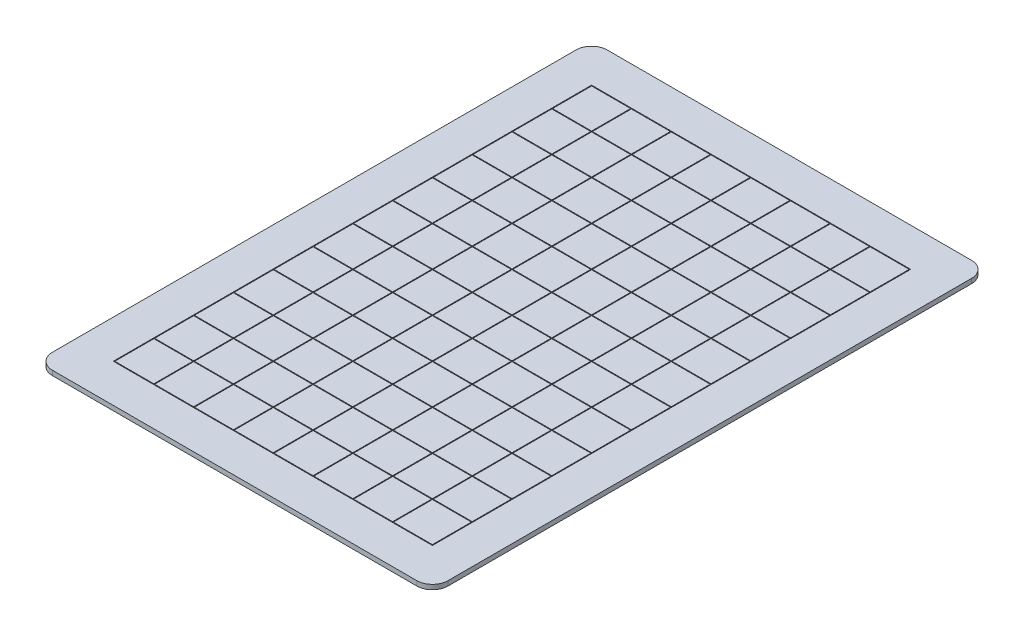
from build123d import *

# Parameters (mm, degrees)
SKETCH1_W           = 253.5
SKETCH1_H           = 355.5
BOSS_EXTRUDE1_DEPTH = 3
SKETCH2_W           = 204.5
SKETCH2_H           = 306.5
SKETCH2_W_2         = 25
SKETCH2_H_2         = 25
CUT_EXTRUDE1_DEPTH  = 0.5
SKETCH4_R           = 1.6
CUT_EXTRUDE2_DEPTH  = 1.2
FILLET1_R           = 10
SKETCH5_W           = 5
SKETCH5_H           = 4
SKETCH5_H_2         = 4.38
CUT_EXTRUDE3_DEPTH  = 2
SKETCH5_3_W         = 5
SKETCH5_3_H         = 4
SKETCH5_3_H_2       = 4.38
CUT_EXTRUDE4_DEPTH  = 2
SKETCH6_W           = 5
SKETCH6_H           = 4
CUT_EXTRUDE6_DEPTH  = 2.5


with BuildPart() as part:
    # Sketch1 → Boss-Extrude1 (new body)
    with BuildSketch(Plane(origin=(0, 0, 0), x_dir=(1, 0, 0), z_dir=(0, 1, 0))):
        with Locations((126.75, 177.75)):
            Rectangle(SKETCH1_W, SKETCH1_H)
    extrude(amount=BOSS_EXTRUDE1_DEPTH)

    # Sketch2 → Cut-Extrude1 (cut)
    with BuildSketch(Plane(origin=(0, 3, 0), x_dir=(1, 0, 0), z_dir=(0, 1, 0))):
        with Locations((126.75, 177.75)):
            Rectangle(SKETCH2_W, SKETCH2_H)
        with Locations((37.5, 37.5)):
            Rectangle(SKETCH2_W_2, SKETCH2_H_2, mode=Mode.SUBTRACT)
        with Locations((63, 37.5)):
            Rectangle(SKETCH2_W_2, SKETCH2_H_2, mode=Mode.SUBTRACT)
        with Locations((88.5, 37.5)):
            Rectangle(SKETCH2_W_2, SKETCH2_H_2, mode=Mode.SUBTRACT)
        with Locations((114, 37.5)):
            Rectangle(SKETCH2_W_2, SKETCH2_H_2, mode=Mode.SUBTRACT)
        with Locations((139.5, 37.5)):
            Rectangle(SKETCH2_W_2, SKETCH2_H_2, mode=Mode.SUBTRACT)
        with Locations((165, 37.5)):
            Rectangle(SKETCH2_W_2, SKETCH2_H_2, mode=Mode.SUBTRACT)
        with Locations((190.5, 37.5)):
            Rectangle(SKETCH2_W_2, SKETCH2_H_2, mode=Mode.SUBTRACT)
        with Locations((216, 37.5)):
            Rectangle(SKETCH2_W_2, SKETCH2_H_2, mode=Mode.SUBTRACT)
        with Locations((63, 63)):
            Rectangle(SKETCH2_W_2, SKETCH2_H_2, mode=Mode.SUBTRACT)
        with Locations((88.5, 63)):
            Rectangle(SKETCH2_W_2, SKETCH2_H_2, mode=Mode.SUBTRACT)
        with Locations((114, 63)):
            Rectangle(SKETCH2_W_2, SKETCH2_H_2, mode=Mode.SUBTRACT)
        with Locations((139.5, 63)):
            Rectangle(SKETCH2_W_2, SKETCH2_H_2, mode=Mode.SUBTRACT)
        with Locations((165, 63)):
            Rectangle(SKETCH2_W_2, SKETCH2_H_2, mode=Mode.SUBTRACT)
        with Locations((190.5, 63)):
            Rectangle(SKETCH2_W_2, SKETCH2_H_2, mode=Mode.SUBTRACT)
        with Locations((216, 63)):
            Rectangle(SKETCH2_W_2, SKETCH2_H_2, mode=Mode.SUBTRACT)
        with Locations((63, 88.5)):
            Rectangle(SKETCH2_W_2, SKETCH2_H_2, mode=Mode.SUBTRACT)
        with Locations((88.5, 88.5)):
            Rectangle(SKETCH2_W_2, SKETCH2_H_2, mode=Mode.SUBTRACT)
        with Locations((114, 88.5)):
            Rectangle(SKETCH2_W_2, SKETCH2_H_2, mode=Mode.SUBTRACT)
        with Locations((139.5, 88.5)):
            Rectangle(SKETCH2_W_2, SKETCH2_H_2, mode=Mode.SUBTRACT)
        with Locations((165, 88.5)):
            Rectangle(SKETCH2_W_2, SKETCH2_H_2, mode=Mode.SUBTRACT)
        with Locations((190.5, 88.5)):
            Rectangle(SKETCH2_W_2, SKETCH2_H_2, mode=Mode.SUBTRACT)
        with Locations((216, 88.5)):
            Rectangle(SKETCH2_W_2, SKETCH2_H_2, mode=Mode.SUBTRACT)
        with Locations((63, 114)):
            Rectangle(SKETCH2_W_2, SKETCH2_H_2, mode=Mode.SUBTRACT)
        with Locations((88.5, 114)):
            Rectangle(SKETCH2_W_2, SKETCH2_H_2, mode=Mode.SUBTRACT)
        with Locations((114, 114)):
            Rectangle(SKETCH2_W_2, SKETCH2_H_2, mode=Mode.SUBTRACT)
        with Locations((139.5, 114)):
            Rectangle(SKETCH2_W_2, SKETCH2_H_2, mode=Mode.SUBTRACT)
        with Locations((165, 114)):
            Rectangle(SKETCH2_W_2, SKETCH2_H_2, mode=Mode.SUBTRACT)
        with Locations((190.5, 114)):
            Rectangle(SKETCH2_W_2, SKETCH2_H_2, mode=Mode.SUBTRACT)
        with Locations((216, 114)):
            Rectangle(SKETCH2_W_2, SKETCH2_H_2, mode=Mode.SUBTRACT)
        with Locations((63, 139.5)):
            Rectangle(SKETCH2_W_2, SKETCH2_H_2, mode=Mode.SUBTRACT)
        with Locations((88.5, 139.5)):
            Rectangle(SKETCH2_W_2, SKETCH2_H_2, mode=Mode.SUBTRACT)
        with Locations((114, 139.5)):
            Rectangle(SKETCH2_W_2, SKETCH2_H_2, mode=Mode.SUBTRACT)
        with Locations((139.5, 139.5)):
            Rectangle(SKETCH2_W_2, SKETCH2_H_2, mode=Mode.SUBTRACT)
        with Locations((165, 139.5)):
            Rectangle(SKETCH2_W_2, SKETCH2_H_2, mode=Mode.SUBTRACT)
        with Locations((190.5, 139.5)):
            Rectangle(SKETCH2_W_2, SKETCH2_H_2, mode=Mode.SUBTRACT)
        with Locations((216, 139.5)):
            Rectangle(SKETCH2_W_2, SKETCH2_H_2, mode=Mode.SUBTRACT)
        with Locations((63, 165)):
            Rectangle(SKETCH2_W_2, SKETCH2_H_2, mode=Mode.SUBTRACT)
        with Locations((88.5, 165)):
            Rectangle(SKETCH2_W_2, SKETCH2_H_2, mode=Mode.SUBTRACT)
        with Locations((114, 165)):
            Rectangle(SKETCH2_W_2, SKETCH2_H_2, mode=Mode.SUBTRACT)
        with Locations((139.5, 165)):
            Rectangle(SKETCH2_W_2, SKETCH2_H_2, mode=Mode.SUBTRACT)
        with Locations((165, 165)):
            Rectangle(SKETCH2_W_2, SKETCH2_H_2, mode=Mode.SUBTRACT)
        with Locations((190.5, 165)):
            Rectangle(SKETCH2_W_2, SKETCH2_H_2, mode=Mode.SUBTRACT)
        with Locations((216, 165)):
            Rectangle(SKETCH2_W_2, SKETCH2_H_2, mode=Mode.SUBTRACT)
        with Locations((63, 190.5)):
            Rectangle(SKETCH2_W_2, SKETCH2_H_2, mode=Mode.SUBTRACT)
        with Locations((88.5, 190.5)):
            Rectangle(SKETCH2_W_2, SKETCH2_H_2, mode=Mode.SUBTRACT)
        with Locations((114, 190.5)):
            Rectangle(SKETCH2_W_2, SKETCH2_H_2, mode=Mode.SUBTRACT)
        with Locations((139.5, 190.5)):
            Rectangle(SKETCH2_W_2, SKETCH2_H_2, mode=Mode.SUBTRACT)
        with Locations((165, 190.5)):
            Rectangle(SKETCH2_W_2, SKETCH2_H_2, mode=Mode.SUBTRACT)
        with Locations((190.5, 190.5)):
            Rectangle(SKETCH2_W_2, SKETCH2_H_2, mode=Mode.SUBTRACT)
        with Locations((216, 190.5)):
            Rectangle(SKETCH2_W_2, SKETCH2_H_2, mode=Mode.SUBTRACT)
        with Locations((63, 216)):
            Rectangle(SKETCH2_W_2, SKETCH2_H_2, mode=Mode.SUBTRACT)
        with Locations((88.5, 216)):
            Rectangle(SKETCH2_W_2, SKETCH2_H_2, mode=Mode.SUBTRACT)
        with Locations((114, 216)):
            Rectangle(SKETCH2_W_2, SKETCH2_H_2, mode=Mode.SUBTRACT)
        with Locations((139.5, 216)):
            Rectangle(SKETCH2_W_2, SKETCH2_H_2, mode=Mode.SUBTRACT)
        with Locations((165, 216)):
            Rectangle(SKETCH2_W_2, SKETCH2_H_2, mode=Mode.SUBTRACT)
        with Locations((190.5, 216)):
            Rectangle(SKETCH2_W_2, SKETCH2_H_2, mode=Mode.SUBTRACT)
        with Locations((216, 216)):
            Rectangle(SKETCH2_W_2, SKETCH2_H_2, mode=Mode.SUBTRACT)
        with Locations((63, 241.5)):
            Rectangle(SKETCH2_W_2, SKETCH2_H_2, mode=Mode.SUBTRACT)
        with Locations((88.5, 241.5)):
            Rectangle(SKETCH2_W_2, SKETCH2_H_2, mode=Mode.SUBTRACT)
        with Locations((114, 241.5)):
            Rectangle(SKETCH2_W_2, SKETCH2_H_2, mode=Mode.SUBTRACT)
        with Locations((139.5, 241.5)):
            Rectangle(SKETCH2_W_2, SKETCH2_H_2, mode=Mode.SUBTRACT)
        with Locations((165, 241.5)):
            Rectangle(SKETCH2_W_2, SKETCH2_H_2, mode=Mode.SUBTRACT)
        with Locations((190.5, 241.5)):
            Rectangle(SKETCH2_W_2, SKETCH2_H_2, mode=Mode.SUBTRACT)
        with Locations((216, 241.5)):
            Rectangle(SKETCH2_W_2, SKETCH2_H_2, mode=Mode.SUBTRACT)
        with Locations((63, 267)):
            Rectangle(SKETCH2_W_2, SKETCH2_H_2, mode=Mode.SUBTRACT)
        with Locations((88.5, 267)):
            Rectangle(SKETCH2_W_2, SKETCH2_H_2, mode=Mode.SUBTRACT)
        with Locations((114, 267)):
            Rectangle(SKETCH2_W_2, SKETCH2_H_2, mode=Mode.SUBTRACT)
        with Locations((139.5, 267)):
            Rectangle(SKETCH2_W_2, SKETCH2_H_2, mode=Mode.SUBTRACT)
        with Locations((165, 267)):
            Rectangle(SKETCH2_W_2, SKETCH2_H_2, mode=Mode.SUBTRACT)
        with Locations((190.5, 267)):
            Rectangle(SKETCH2_W_2, SKETCH2_H_2, mode=Mode.SUBTRACT)
        with Locations((216, 267)):
            Rectangle(SKETCH2_W_2, SKETCH2_H_2, mode=Mode.SUBTRACT)
        with Locations((63, 292.5)):
            Rectangle(SKETCH2_W_2, SKETCH2_H_2, mode=Mode.SUBTRACT)
        with Locations((88.5, 292.5)):
            Rectangle(SKETCH2_W_2, SKETCH2_H_2, mode=Mode.SUBTRACT)
        with Locations((114, 292.5)):
            Rectangle(SKETCH2_W_2, SKETCH2_H_2, mode=Mode.SUBTRACT)
        with Locations((139.5, 292.5)):
            Rectangle(SKETCH2_W_2, SKETCH2_H_2, mode=Mode.SUBTRACT)
        with Locations((165, 292.5)):
            Rectangle(SKETCH2_W_2, SKETCH2_H_2, mode=Mode.SUBTRACT)
        with Locations((190.5, 292.5)):
            Rectangle(SKETCH2_W_2, SKETCH2_H_2, mode=Mode.SUBTRACT)
        with Locations((216, 292.5)):
            Rectangle(SKETCH2_W_2, SKETCH2_H_2, mode=Mode.SUBTRACT)
        with Locations((63, 318)):
            Rectangle(SKETCH2_W_2, SKETCH2_H_2, mode=Mode.SUBTRACT)
        with Locations((88.5, 318)):
            Rectangle(SKETCH2_W_2, SKETCH2_H_2, mode=Mode.SUBTRACT)
        with Locations((114, 318)):
            Rectangle(SKETCH2_W_2, SKETCH2_H_2, mode=Mode.SUBTRACT)
        with Locations((139.5, 318)):
            Rectangle(SKETCH2_W_2, SKETCH2_H_2, mode=Mode.SUBTRACT)
        with Locations((165, 318)):
            Rectangle(SKETCH2_W_2, SKETCH2_H_2, mode=Mode.SUBTRACT)
        with Locations((190.5, 318)):
            Rectangle(SKETCH2_W_2, SKETCH2_H_2, mode=Mode.SUBTRACT)
        with Locations((216, 318)):
            Rectangle(SKETCH2_W_2, SKETCH2_H_2, mode=Mode.SUBTRACT)
        with Locations((37.5, 63)):
            Rectangle(SKETCH2_W_2, SKETCH2_H_2, mode=Mode.SUBTRACT)
        with Locations((37.5, 88.5)):
            Rectangle(SKETCH2_W_2, SKETCH2_H_2, mode=Mode.SUBTRACT)
        with Locations((37.5, 114)):
            Rectangle(SKETCH2_W_2, SKETCH2_H_2, mode=Mode.SUBTRACT)
        with Locations((37.5, 139.5)):
            Rectangle(SKETCH2_W_2, SKETCH2_H_2, mode=Mode.SUBTRACT)
        with Locations((37.5, 165)):
            Rectangle(SKETCH2_W_2, SKETCH2_H_2, mode=Mode.SUBTRACT)
        with Locations((37.5, 190.5)):
            Rectangle(SKETCH2_W_2, SKETCH2_H_2, mode=Mode.SUBTRACT)
        with Locations((37.5, 216)):
            Rectangle(SKETCH2_W_2, SKETCH2_H_2, mode=Mode.SUBTRACT)
        with Locations((37.5, 241.5)):
            Rectangle(SKETCH2_W_2, SKETCH2_H_2, mode=Mode.SUBTRACT)
        with Locations((37.5, 267)):
            Rectangle(SKETCH2_W_2, SKETCH2_H_2, mode=Mode.SUBTRACT)
        with Locations((37.5, 292.5)):
            Rectangle(SKETCH2_W_2, SKETCH2_H_2, mode=Mode.SUBTRACT)
        with Locations((37.5, 318)):
            Rectangle(SKETCH2_W_2, SKETCH2_H_2, mode=Mode.SUBTRACT)
    extrude(amount=-CUT_EXTRUDE1_DEPTH, mode=Mode.SUBTRACT)

    # Sketch4 → Cut-Extrude2 (cut)
    with BuildSketch(Plane.XZ):
        with Locations((6, -177.75)):
            Circle(SKETCH4_R)
        with Locations((247.5, -177.75)):
            Circle(SKETCH4_R)
        with Locations((6, -6)):
            Circle(SKETCH4_R)
        with Locations((6, -91.875)):
            Circle(SKETCH4_R)
        with Locations((6, -263.625)):
            Circle(SKETCH4_R)
        with Locations((6, -349.5)):
            Circle(SKETCH4_R)
        with Locations((247.5, -6)):
            Circle(SKETCH4_R)
        with Locations((247.5, -91.875)):
            Circle(SKETCH4_R)
        with Locations((247.5, -263.625)):
            Circle(SKETCH4_R)
        with Locations((86.5, -349.5)):
            Circle(SKETCH4_R)
        with Locations((167, -349.5)):
            Circle(SKETCH4_R)
        with Locations((247.5, -349.5)):
            Circle(SKETCH4_R)
        with Locations((167, -6)):
            Circle(SKETCH4_R)
        with Locations((86.5, -6)):
            Circle(SKETCH4_R)
    extrude(amount=-CUT_EXTRUDE2_DEPTH, mode=Mode.SUBTRACT)

    # Fillet1
    fillet1_edges = [part.edges().sort_by_distance(p)[0] for p in [
        (253.5, 1.5, 0),
        (0, 1.5, 0),
        (0, 1.5, -355.5),
        (253.5, 1.5, -355.5),
    ]]
    fillet(fillet1_edges, radius=FILLET1_R)

    # Sketch5 → Cut-Extrude3 (cut)
    with BuildSketch(Plane.XZ):
        with Locations((190.5, -241.5)):
            Rectangle(SKETCH5_W, SKETCH5_H)
        with Locations((190.5, -247.69)):
            Rectangle(SKETCH5_W, SKETCH5_H_2)
        with Locations((190.5, -216)):
            Rectangle(SKETCH5_W, SKETCH5_H)
        with Locations((190.5, -222.19)):
            Rectangle(SKETCH5_W, SKETCH5_H_2)
        with Locations((165, -216)):
            Rectangle(SKETCH5_W, SKETCH5_H)
        with Locations((165, -222.19)):
            Rectangle(SKETCH5_W, SKETCH5_H_2)
        with Locations((139.5, -216)):
            Rectangle(SKETCH5_W, SKETCH5_H)
        with Locations((139.5, -222.19)):
            Rectangle(SKETCH5_W, SKETCH5_H_2)
        with Locations((114, -216)):
            Rectangle(SKETCH5_W, SKETCH5_H)
        with Locations((114, -222.19)):
            Rectangle(SKETCH5_W, SKETCH5_H_2)
        with Locations((88.5, -216)):
            Rectangle(SKETCH5_W, SKETCH5_H)
        with Locations((88.5, -222.19)):
            Rectangle(SKETCH5_W, SKETCH5_H_2)
        with Locations((63, -216)):
            Rectangle(SKETCH5_W, SKETCH5_H)
        with Locations((63, -222.19)):
            Rectangle(SKETCH5_W, SKETCH5_H_2)
        with Locations((37.5, -216)):
            Rectangle(SKETCH5_W, SKETCH5_H)
        with Locations((37.5, -222.19)):
            Rectangle(SKETCH5_W, SKETCH5_H_2)
        with Locations((190.5, -190.5)):
            Rectangle(SKETCH5_W, SKETCH5_H)
        with Locations((190.5, -196.69)):
            Rectangle(SKETCH5_W, SKETCH5_H_2)
        with Locations((165, -190.5)):
            Rectangle(SKETCH5_W, SKETCH5_H)
        with Locations((165, -196.69)):
            Rectangle(SKETCH5_W, SKETCH5_H_2)
        with Locations((139.5, -190.5)):
            Rectangle(SKETCH5_W, SKETCH5_H)
        with Locations((139.5, -196.69)):
            Rectangle(SKETCH5_W, SKETCH5_H_2)
        with Locations((114, -190.5)):
            Rectangle(SKETCH5_W, SKETCH5_H)
        with Locations((114, -196.69)):
            Rectangle(SKETCH5_W, SKETCH5_H_2)
        with Locations((88.5, -190.5)):
            Rectangle(SKETCH5_W, SKETCH5_H)
        with Locations((88.5, -196.69)):
            Rectangle(SKETCH5_W, SKETCH5_H_2)
        with Locations((63, -190.5)):
            Rectangle(SKETCH5_W, SKETCH5_H)
        with Locations((63, -196.69)):
            Rectangle(SKETCH5_W, SKETCH5_H_2)
        with Locations((37.5, -190.5)):
            Rectangle(SKETCH5_W, SKETCH5_H)
        with Locations((37.5, -196.69)):
            Rectangle(SKETCH5_W, SKETCH5_H_2)
        with Locations((190.5, -165)):
            Rectangle(SKETCH5_W, SKETCH5_H)
        with Locations((190.5, -171.19)):
            Rectangle(SKETCH5_W, SKETCH5_H_2)
        with Locations((165, -165)):
            Rectangle(SKETCH5_W, SKETCH5_H)
        with Locations((165, -171.19)):
            Rectangle(SKETCH5_W, SKETCH5_H_2)
        with Locations((139.5, -165)):
            Rectangle(SKETCH5_W, SKETCH5_H)
        with Locations((139.5, -171.19)):
            Rectangle(SKETCH5_W, SKETCH5_H_2)
        with Locations((114, -165)):
            Rectangle(SKETCH5_W, SKETCH5_H)
        with Locations((114, -171.19)):
            Rectangle(SKETCH5_W, SKETCH5_H_2)
        with Locations((88.5, -165)):
            Rectangle(SKETCH5_W, SKETCH5_H)
        with Locations((88.5, -171.19)):
            Rectangle(SKETCH5_W, SKETCH5_H_2)
        with Locations((63, -165)):
            Rectangle(SKETCH5_W, SKETCH5_H)
        with Locations((63, -171.19)):
            Rectangle(SKETCH5_W, SKETCH5_H_2)
        with Locations((37.5, -165)):
            Rectangle(SKETCH5_W, SKETCH5_H)
        with Locations((37.5, -171.19)):
            Rectangle(SKETCH5_W, SKETCH5_H_2)
        with Locations((190.5, -139.5)):
            Rectangle(SKETCH5_W, SKETCH5_H)
        with Locations((190.5, -145.69)):
            Rectangle(SKETCH5_W, SKETCH5_H_2)
        with Locations((165, -139.5)):
            Rectangle(SKETCH5_W, SKETCH5_H)
        with Locations((165, -145.69)):
            Rectangle(SKETCH5_W, SKETCH5_H_2)
        with Locations((139.5, -139.5)):
            Rectangle(SKETCH5_W, SKETCH5_H)
        with Locations((139.5, -145.69)):
            Rectangle(SKETCH5_W, SKETCH5_H_2)
        with Locations((114, -139.5)):
            Rectangle(SKETCH5_W, SKETCH5_H)
        with Locations((114, -145.69)):
            Rectangle(SKETCH5_W, SKETCH5_H_2)
        with Locations((88.5, -139.5)):
            Rectangle(SKETCH5_W, SKETCH5_H)
        with Locations((88.5, -145.69)):
            Rectangle(SKETCH5_W, SKETCH5_H_2)
        with Locations((63, -139.5)):
            Rectangle(SKETCH5_W, SKETCH5_H)
        with Locations((63, -145.69)):
            Rectangle(SKETCH5_W, SKETCH5_H_2)
        with Locations((37.5, -139.5)):
            Rectangle(SKETCH5_W, SKETCH5_H)
        with Locations((37.5, -145.69)):
            Rectangle(SKETCH5_W, SKETCH5_H_2)
        with Locations((190.5, -114)):
            Rectangle(SKETCH5_W, SKETCH5_H)
        with Locations((190.5, -120.19)):
            Rectangle(SKETCH5_W, SKETCH5_H_2)
        with Locations((165, -114)):
            Rectangle(SKETCH5_W, SKETCH5_H)
        with Locations((165, -120.19)):
            Rectangle(SKETCH5_W, SKETCH5_H_2)
        with Locations((139.5, -114)):
            Rectangle(SKETCH5_W, SKETCH5_H)
        with Locations((139.5, -120.19)):
            Rectangle(SKETCH5_W, SKETCH5_H_2)
        with Locations((114, -114)):
            Rectangle(SKETCH5_W, SKETCH5_H)
        with Locations((114, -120.19)):
            Rectangle(SKETCH5_W, SKETCH5_H_2)
        with Locations((88.5, -114)):
            Rectangle(SKETCH5_W, SKETCH5_H)
        with Locations((88.5, -120.19)):
            Rectangle(SKETCH5_W, SKETCH5_H_2)
        with Locations((63, -114)):
            Rectangle(SKETCH5_W, SKETCH5_H)
        with Locations((63, -120.19)):
            Rectangle(SKETCH5_W, SKETCH5_H_2)
        with Locations((37.5, -114)):
            Rectangle(SKETCH5_W, SKETCH5_H)
        with Locations((37.5, -120.19)):
            Rectangle(SKETCH5_W, SKETCH5_H_2)
        with Locations((190.5, -88.5)):
            Rectangle(SKETCH5_W, SKETCH5_H)
        with Locations((190.5, -94.69)):
            Rectangle(SKETCH5_W, SKETCH5_H_2)
        with Locations((165, -88.5)):
            Rectangle(SKETCH5_W, SKETCH5_H)
        with Locations((165, -94.69)):
            Rectangle(SKETCH5_W, SKETCH5_H_2)
        with Locations((139.5, -88.5)):
            Rectangle(SKETCH5_W, SKETCH5_H)
        with Locations((139.5, -94.69)):
            Rectangle(SKETCH5_W, SKETCH5_H_2)
        with Locations((114, -88.5)):
            Rectangle(SKETCH5_W, SKETCH5_H)
        with Locations((114, -94.69)):
            Rectangle(SKETCH5_W, SKETCH5_H_2)
        with Locations((88.5, -88.5)):
            Rectangle(SKETCH5_W, SKETCH5_H)
        with Locations((88.5, -94.69)):
            Rectangle(SKETCH5_W, SKETCH5_H_2)
        with Locations((63, -88.5)):
            Rectangle(SKETCH5_W, SKETCH5_H)
        with Locations((63, -94.69)):
            Rectangle(SKETCH5_W, SKETCH5_H_2)
        with Locations((37.5, -88.5)):
            Rectangle(SKETCH5_W, SKETCH5_H)
        with Locations((37.5, -94.69)):
            Rectangle(SKETCH5_W, SKETCH5_H_2)
        with Locations((216, -241.5)):
            Rectangle(SKETCH5_W, SKETCH5_H)
        with Locations((216, -247.69)):
            Rectangle(SKETCH5_W, SKETCH5_H_2)
        with Locations((216, -216)):
            Rectangle(SKETCH5_W, SKETCH5_H)
        with Locations((216, -222.19)):
            Rectangle(SKETCH5_W, SKETCH5_H_2)
        with Locations((216, -190.5)):
            Rectangle(SKETCH5_W, SKETCH5_H)
        with Locations((216, -196.69)):
            Rectangle(SKETCH5_W, SKETCH5_H_2)
        with Locations((216, -165)):
            Rectangle(SKETCH5_W, SKETCH5_H)
        with Locations((216, -171.19)):
            Rectangle(SKETCH5_W, SKETCH5_H_2)
        with Locations((216, -139.5)):
            Rectangle(SKETCH5_W, SKETCH5_H)
        with Locations((216, -145.69)):
            Rectangle(SKETCH5_W, SKETCH5_H_2)
        with Locations((216, -114)):
            Rectangle(SKETCH5_W, SKETCH5_H)
        with Locations((216, -120.19)):
            Rectangle(SKETCH5_W, SKETCH5_H_2)
        with Locations((216, -88.5)):
            Rectangle(SKETCH5_W, SKETCH5_H)
        with Locations((216, -94.69)):
            Rectangle(SKETCH5_W, SKETCH5_H_2)
    extrude(amount=-CUT_EXTRUDE3_DEPTH, mode=Mode.SUBTRACT)

    # Sketch5<3> → Cut-Extrude4 (cut)
    with BuildSketch(Plane.XZ):
        with Locations((216, -267)):
            Rectangle(SKETCH5_3_W, SKETCH5_3_H)
        with Locations((216, -273.19)):
            Rectangle(SKETCH5_3_W, SKETCH5_3_H_2)
        with Locations((190.5, -267)):
            Rectangle(SKETCH5_3_W, SKETCH5_3_H)
        with Locations((190.5, -273.19)):
            Rectangle(SKETCH5_3_W, SKETCH5_3_H_2)
        with Locations((165, -267)):
            Rectangle(SKETCH5_3_W, SKETCH5_3_H)
        with Locations((165, -273.19)):
            Rectangle(SKETCH5_3_W, SKETCH5_3_H_2)
        with Locations((139.5, -267)):
            Rectangle(SKETCH5_3_W, SKETCH5_3_H)
        with Locations((139.5, -273.19)):
            Rectangle(SKETCH5_3_W, SKETCH5_3_H_2)
        with Locations((114, -267)):
            Rectangle(SKETCH5_3_W, SKETCH5_3_H)
        with Locations((114, -273.19)):
            Rectangle(SKETCH5_3_W, SKETCH5_3_H_2)
        with Locations((88.5, -267)):
            Rectangle(SKETCH5_3_W, SKETCH5_3_H)
        with Locations((88.5, -273.19)):
            Rectangle(SKETCH5_3_W, SKETCH5_3_H_2)
        with Locations((63, -267)):
            Rectangle(SKETCH5_3_W, SKETCH5_3_H)
        with Locations((63, -273.19)):
            Rectangle(SKETCH5_3_W, SKETCH5_3_H_2)
        with Locations((37.5, -267)):
            Rectangle(SKETCH5_3_W, SKETCH5_3_H)
        with Locations((37.5, -273.19)):
            Rectangle(SKETCH5_3_W, SKETCH5_3_H_2)
        with Locations((165, -241.5)):
            Rectangle(SKETCH5_3_W, SKETCH5_3_H)
        with Locations((165, -247.69)):
            Rectangle(SKETCH5_3_W, SKETCH5_3_H_2)
        with Locations((139.5, -241.5)):
            Rectangle(SKETCH5_3_W, SKETCH5_3_H)
        with Locations((139.5, -247.69)):
            Rectangle(SKETCH5_3_W, SKETCH5_3_H_2)
        with Locations((114, -241.5)):
            Rectangle(SKETCH5_3_W, SKETCH5_3_H)
        with Locations((114, -247.69)):
            Rectangle(SKETCH5_3_W, SKETCH5_3_H_2)
        with Locations((88.5, -241.5)):
            Rectangle(SKETCH5_3_W, SKETCH5_3_H)
        with Locations((88.5, -247.69)):
            Rectangle(SKETCH5_3_W, SKETCH5_3_H_2)
        with Locations((63, -241.5)):
            Rectangle(SKETCH5_3_W, SKETCH5_3_H)
        with Locations((63, -247.69)):
            Rectangle(SKETCH5_3_W, SKETCH5_3_H_2)
        with Locations((37.5, -241.5)):
            Rectangle(SKETCH5_3_W, SKETCH5_3_H)
        with Locations((37.5, -247.69)):
            Rectangle(SKETCH5_3_W, SKETCH5_3_H_2)
    extrude(amount=-CUT_EXTRUDE4_DEPTH, mode=Mode.SUBTRACT)

    # Sketch6 → Cut-Extrude6 (cut)
    with BuildSketch(Plane.XZ):
        with Locations((37.5, -190.5)):
            Rectangle(SKETCH6_W, SKETCH6_H)
        with Locations((63, -190.5)):
            Rectangle(SKETCH6_W, SKETCH6_H)
        with Locations((63, -165)):
            Rectangle(SKETCH6_W, SKETCH6_H)
        with Locations((37.5, -165)):
            Rectangle(SKETCH6_W, SKETCH6_H)
        with Locations((37.5, -139.5)):
            Rectangle(SKETCH6_W, SKETCH6_H)
        with Locations((63, -139.5)):
            Rectangle(SKETCH6_W, SKETCH6_H)
        with Locations((37.5, -114)):
            Rectangle(SKETCH6_W, SKETCH6_H)
        with Locations((63, -114)):
            Rectangle(SKETCH6_W, SKETCH6_H)
        with Locations((37.5, -88.5)):
            Rectangle(SKETCH6_W, SKETCH6_H)
        with Locations((63, -88.5)):
            Rectangle(SKETCH6_W, SKETCH6_H)
        with Locations((63, -216)):
            Rectangle(SKETCH6_W, SKETCH6_H)
        with Locations((37.5, -216)):
            Rectangle(SKETCH6_W, SKETCH6_H)
        with Locations((37.5, -241.5)):
            Rectangle(SKETCH6_W, SKETCH6_H)
        with Locations((63, -241.5)):
            Rectangle(SKETCH6_W, SKETCH6_H)
        with Locations((37.5, -267)):
            Rectangle(SKETCH6_W, SKETCH6_H)
        with Locations((63, -267)):
            Rectangle(SKETCH6_W, SKETCH6_H)
        with Locations((88.5, -267)):
            Rectangle(SKETCH6_W, SKETCH6_H)
        with Locations((88.5, -241.5)):
            Rectangle(SKETCH6_W, SKETCH6_H)
        with Locations((88.5, -216)):
            Rectangle(SKETCH6_W, SKETCH6_H)
        with Locations((88.5, -190.5)):
            Rectangle(SKETCH6_W, SKETCH6_H)
        with Locations((88.5, -165)):
            Rectangle(SKETCH6_W, SKETCH6_H)
        with Locations((88.5, -139.5)):
            Rectangle(SKETCH6_W, SKETCH6_H)
        with Locations((88.5, -114)):
            Rectangle(SKETCH6_W, SKETCH6_H)
        with Locations((88.5, -88.5)):
            Rectangle(SKETCH6_W, SKETCH6_H)
        with Locations((114, -267)):
            Rectangle(SKETCH6_W, SKETCH6_H)
        with Locations((114, -241.5)):
            Rectangle(SKETCH6_W, SKETCH6_H)
        with Locations((114, -216)):
            Rectangle(SKETCH6_W, SKETCH6_H)
        with Locations((114, -190.5)):
            Rectangle(SKETCH6_W, SKETCH6_H)
        with Locations((114, -165)):
            Rectangle(SKETCH6_W, SKETCH6_H)
        with Locations((114, -139.5)):
            Rectangle(SKETCH6_W, SKETCH6_H)
        with Locations((114, -114)):
            Rectangle(SKETCH6_W, SKETCH6_H)
        with Locations((114, -88.5)):
            Rectangle(SKETCH6_W, SKETCH6_H)
        with Locations((139.5, -267)):
            Rectangle(SKETCH6_W, SKETCH6_H)
        with Locations((139.5, -241.5)):
            Rectangle(SKETCH6_W, SKETCH6_H)
        with Locations((139.5, -216)):
            Rectangle(SKETCH6_W, SKETCH6_H)
        with Locations((139.5, -190.5)):
            Rectangle(SKETCH6_W, SKETCH6_H)
        with Locations((139.5, -165)):
            Rectangle(SKETCH6_W, SKETCH6_H)
        with Locations((139.5, -139.5)):
            Rectangle(SKETCH6_W, SKETCH6_H)
        with Locations((139.5, -114)):
            Rectangle(SKETCH6_W, SKETCH6_H)
        with Locations((139.5, -88.5)):
            Rectangle(SKETCH6_W, SKETCH6_H)
        with Locations((165, -267)):
            Rectangle(SKETCH6_W, SKETCH6_H)
        with Locations((165, -241.5)):
            Rectangle(SKETCH6_W, SKETCH6_H)
        with Locations((165, -216)):
            Rectangle(SKETCH6_W, SKETCH6_H)
        with Locations((165, -190.5)):
            Rectangle(SKETCH6_W, SKETCH6_H)
        with Locations((165, -165)):
            Rectangle(SKETCH6_W, SKETCH6_H)
        with Locations((165, -139.5)):
            Rectangle(SKETCH6_W, SKETCH6_H)
        with Locations((165, -114)):
            Rectangle(SKETCH6_W, SKETCH6_H)
        with Locations((165, -88.5)):
            Rectangle(SKETCH6_W, SKETCH6_H)
        with Locations((190.5, -267)):
            Rectangle(SKETCH6_W, SKETCH6_H)
        with Locations((190.5, -241.5)):
            Rectangle(SKETCH6_W, SKETCH6_H)
        with Locations((190.5, -216)):
            Rectangle(SKETCH6_W, SKETCH6_H)
        with Locations((190.5, -190.5)):
            Rectangle(SKETCH6_W, SKETCH6_H)
        with Locations((190.5, -165)):
            Rectangle(SKETCH6_W, SKETCH6_H)
        with Locations((190.5, -139.5)):
            Rectangle(SKETCH6_W, SKETCH6_H)
        with Locations((190.5, -114)):
            Rectangle(SKETCH6_W, SKETCH6_H)
        with Locations((190.5, -88.5)):
            Rectangle(SKETCH6_W, SKETCH6_H)
        with Locations((216, -267)):
            Rectangle(SKETCH6_W, SKETCH6_H)
        with Locations((216, -241.5)):
            Rectangle(SKETCH6_W, SKETCH6_H)
        with Locations((216, -216)):
            Rectangle(SKETCH6_W, SKETCH6_H)
        with Locations((216, -190.5)):
            Rectangle(SKETCH6_W, SKETCH6_H)
        with Locations((216, -165)):
            Rectangle(SKETCH6_W, SKETCH6_H)
        with Locations((216, -139.5)):
            Rectangle(SKETCH6_W, SKETCH6_H)
        with Locations((216, -114)):
            Rectangle(SKETCH6_W, SKETCH6_H)
        with Locations((216, -88.5)):
            Rectangle(SKETCH6_W, SKETCH6_H)
    extrude(amount=-CUT_EXTRUDE6_DEPTH, mode=Mode.SUBTRACT)


solid = part.part
